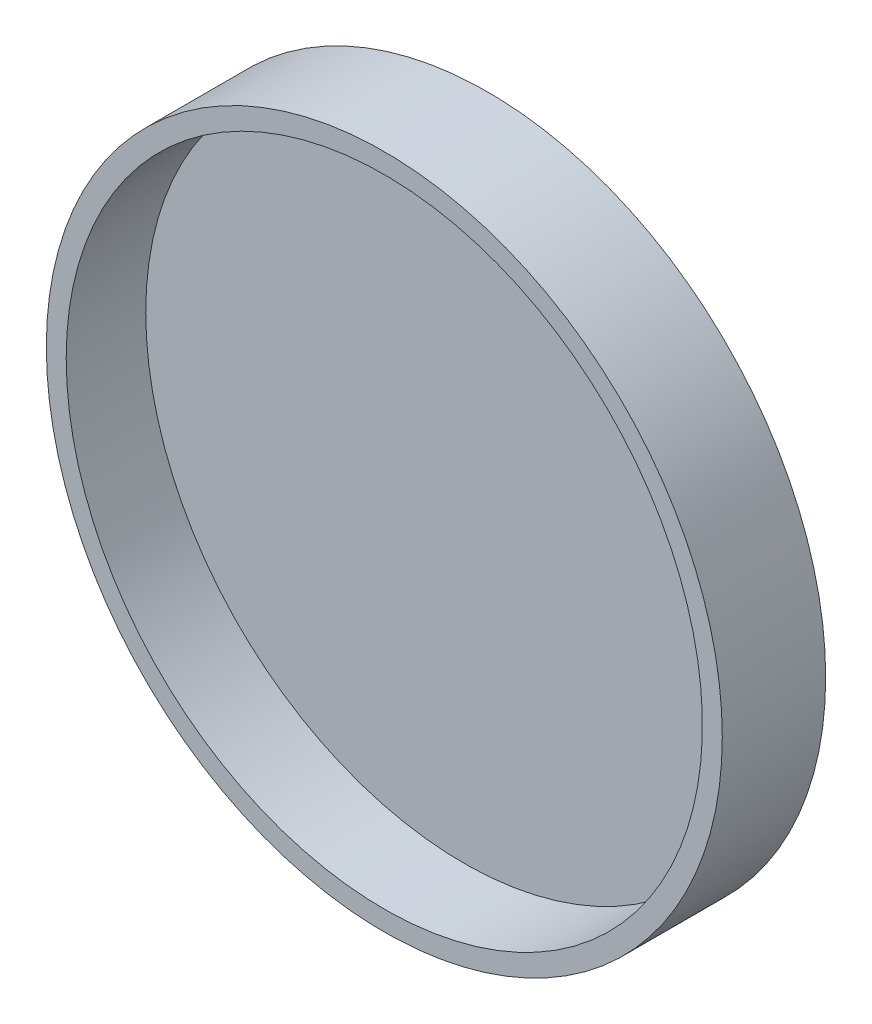
from build123d import *

# Parameters (mm, degrees)
SKETCH1_R           = 53.975
BOSS_EXTRUDE1_DEPTH = 3.81
SKETCH2_R           = 53.975
SKETCH2_R_2         = 50.8
BOSS_EXTRUDE2_DEPTH = 12.7


with BuildPart() as part:
    # Sketch1 → Boss-Extrude1 (new body)
    with BuildSketch(Plane.XY):
        Circle(SKETCH1_R)
    extrude(amount=BOSS_EXTRUDE1_DEPTH)

    # Sketch2 → Boss-Extrude2 (add)
    with BuildSketch(Plane.XY.offset(3.81)):
        Circle(SKETCH2_R)
        Circle(SKETCH2_R_2, mode=Mode.SUBTRACT)
    extrude(amount=BOSS_EXTRUDE2_DEPTH)


solid = part.part
